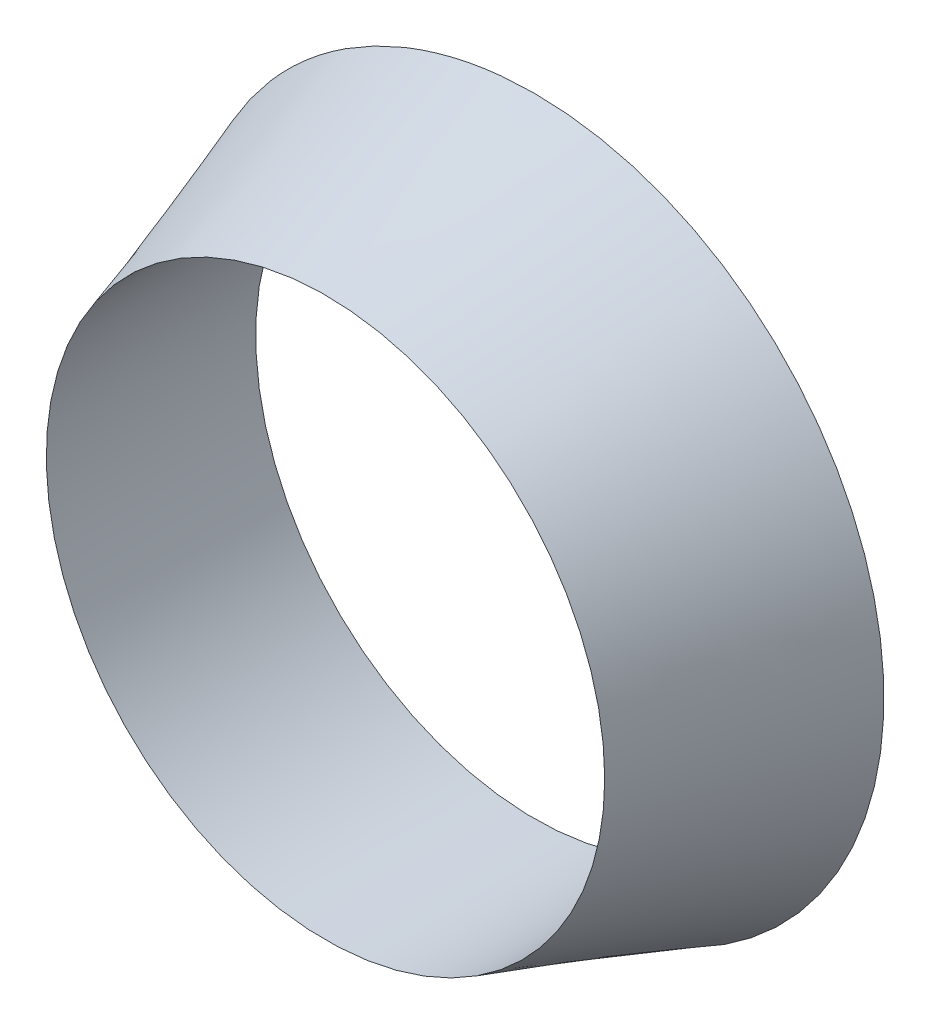
from build123d import *

# Parameters (mm, degrees)
SKETCH4_R          = 4
CUT_EXTRUDE1_DEPTH = 10


with BuildPart() as part:
    # Loft1: read off the stored shape, not the designer's step
    # Loft1: loft between two sections, ruled curve by curve
    loft1_from = [
        Edge.make_bspline([(2.510765445, -3.113849206, 0), (-3.716932967, -8.135380097, 0), (-8.738463858, -1.907681684, 0), (-2.510765445, 3.113849206, 0), (3.716932967, 8.135380097, 0), (8.738463858, 1.907681684, 0), (2.510765445, -3.113849206, 0)], [0, 0, 0, 0, 0.5, 0.5, 0.5, 1, 1, 1, 1], 3, [1, 0.333333333, 0.333333333, 1, 0.333333333, 0.333333333, 1]),
    ]
    loft1_to = [
        Edge.make_bspline([(2.300689012, -4.439237555, -3), (-6.577786098, -9.040615579, -3), (-11.179164122, -0.16214047, -3), (-2.300689012, 4.439237555, -3), (6.577786098, 9.040615579, -3), (11.179164122, 0.16214047, -3), (2.300689012, -4.439237555, -3)], [0, 0, 0, 0, 0.5, 0.5, 0.5, 1, 1, 1, 1], 3, [1, 0.333333333, 0.333333333, 1, 0.333333333, 0.333333333, 1]),
    ]
    loft1 = Solid(Shell([*[Face.make_surface_from_curves(loft1_from[k], loft1_to[k]) for k in range(1)], Face(Wire(loft1_from)), Face(Wire(loft1_to))]))
    add(loft1)

    # Sketch4 → Cut-Extrude1 (cut)
    with BuildSketch(Plane.XY):
        Circle(SKETCH4_R)
    extrude(amount=-CUT_EXTRUDE1_DEPTH, mode=Mode.SUBTRACT)


solid = part.part
